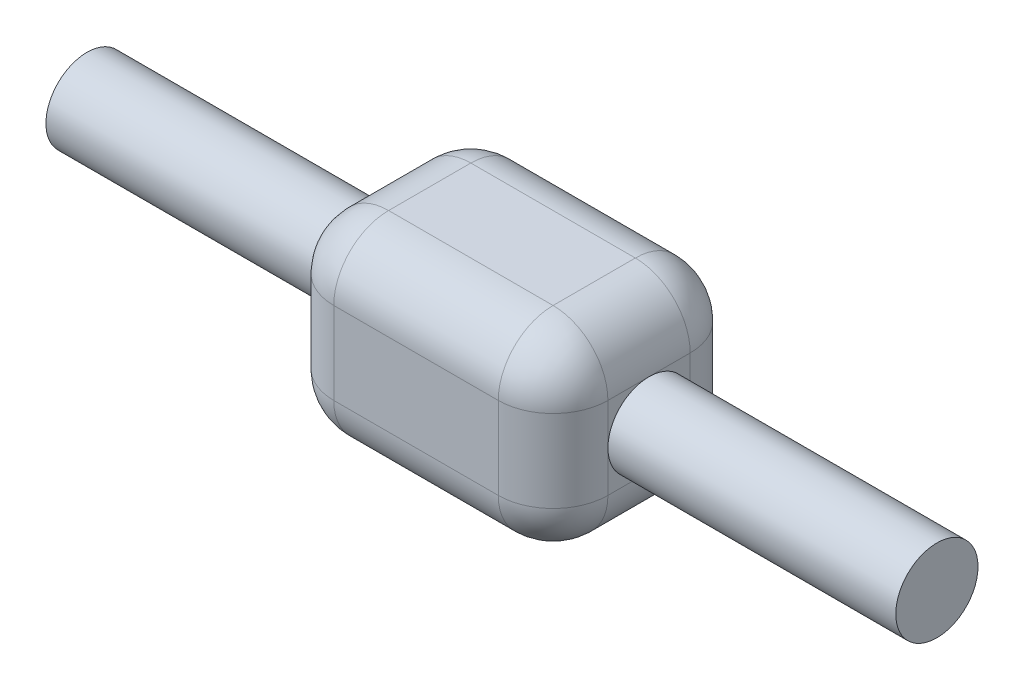
from build123d import *

# Parameters (mm, degrees)
SKETCH_2_R      = 7.5
EXTRUDE_1_DEPTH = 77.5
SKETCH_3_W      = 35
SKETCH_3_H      = 35
EXTRUDE_2_DEPTH = 25
FILLET_1_R      = 10
FILLET_2_R      = 10


with BuildPart() as part:
    # 草图2 → 凸台-拉伸1 (new, symmetric)
    with BuildSketch(Plane(origin=(0, 0, 0), x_dir=(0, 0, -1), z_dir=(1, 0, 0))):
        Circle(SKETCH_2_R)
    extrude(amount=EXTRUDE_1_DEPTH, both=True)

    # 草图3 → 凸台-拉伸2 (add, symmetric)
    with BuildSketch(Plane(origin=(0, 0, 0), x_dir=(0, 0, -1), z_dir=(1, 0, 0))):
        Rectangle(SKETCH_3_W, SKETCH_3_H)
    extrude(amount=EXTRUDE_2_DEPTH, both=True)

    # 圆角1
    fillet_1_edges = [part.edges().sort_by_distance(p)[0] for p in [
        (0, 17.5, 17.5),
        (0, -17.5, 17.5),
        (0, -17.5, -17.5),
        (0, 17.5, -17.5),
    ]]
    fillet(fillet_1_edges, radius=FILLET_1_R)

    # 圆角2
    fillet_2_edges = [part.edges().sort_by_distance(p)[0] for p in [
        (-25, 0, -17.5),
        (25, 0, -17.5),
        (-25, 0, 17.5),
        (-25, 17.5, 0),
        (-25, -17.5, 0),
        (-25, 14.571067812, 14.571067812),
        (-25, -14.571067812, 14.571067812),
        (-25, 14.571067812, -14.571067812),
        (-25, -14.571067812, -14.571067812),
        (25, -17.5, 0),
        (25, 0, 17.5),
        (25, 17.5, 0),
        (25, 14.571067812, 14.571067812),
        (25, -14.571067812, 14.571067812),
        (25, 14.571067812, -14.571067812),
        (25, -14.571067812, -14.571067812),
    ]]
    fillet(fillet_2_edges, radius=FILLET_2_R - 0.0001)  # a hair under: the kernel refuses the full size


solid = part.part
